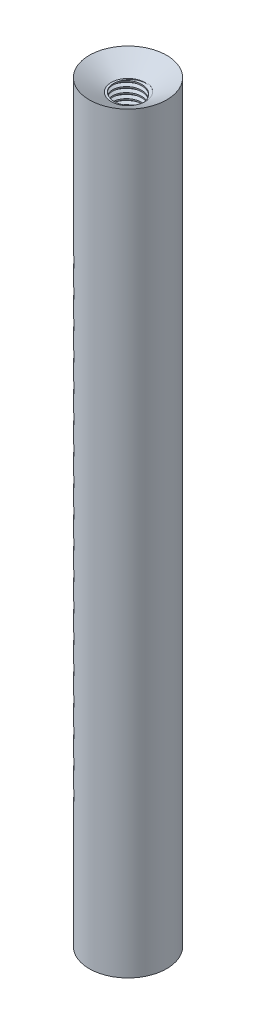
from build123d import *

# Parameters (mm, degrees)
SKETCH1_R                 = 9.25
BOSS_EXTRUDE1_DEPTH       = 180
M8X1_0_TAPPED_HOLE1_D     = 7
M8X1_0_TAPPED_HOLE1_DEPTH = 16.896987833
M8X1_0_TAPPED_HOLE1_TIP   = 2.103012167
M8X1_0_TAPPED_HOLE2_D     = 7
M8X1_0_TAPPED_HOLE2_DEPTH = 16.896987833
M8X1_0_TAPPED_HOLE2_TIP   = 2.103012167
CUT_EXTRUDE2_DEPTH        = 181.474721222
CUT_EXTRUDE2_DEPTH_BACK   = 181.474721222
THREAD1_PITCH             = 1.25
THREAD2_PITCH             = 1.25


with BuildPart() as part:
    # Sketch1 → Boss-Extrude1 (new body)
    with BuildSketch(Plane(origin=(0, 0, 0), x_dir=(1, 0, 0), z_dir=(0, 1, 0))):
        with Locations(Location((0, 0, 0), (0, 0, 90))):
            Circle(SKETCH1_R)
    extrude(amount=BOSS_EXTRUDE1_DEPTH)

    # Sketch6 → Cut-Revolve2 (revolve, cut)
    with BuildSketch(Plane.XY, mode=Mode.PRIVATE) as cut_revolve2_sk:
        Polygon((0, 177), (4, 177), (39.314590237, 197.17976585), (0, 197.17976585), align=None)
        Polygon((0, 3), (4, 3), (39.314590237, -17.17976585), (0, -17.17976585), align=None)
    revolve(cut_revolve2_sk.sketch.rotate(Axis((0, 270.969491597, 0), (0, -1, 0)), 90), axis=Axis((0, 270.969491597, 0), (0, -1, 0)), mode=Mode.SUBTRACT)

    # M8x1.0 Tapped Hole1
    with Locations(Plane(origin=(0, 177, 0), x_dir=(1, 0, 0), z_dir=(0, 1, 0))):
        with Locations((0, 0)):
            Hole(M8X1_0_TAPPED_HOLE1_D / 2, depth=M8X1_0_TAPPED_HOLE1_DEPTH)
            with Locations((0, 0, -(M8X1_0_TAPPED_HOLE1_DEPTH + M8X1_0_TAPPED_HOLE1_TIP / 2))):  # 118° drill point
                Cone(0, M8X1_0_TAPPED_HOLE1_D / 2, M8X1_0_TAPPED_HOLE1_TIP, mode=Mode.SUBTRACT)

    # M8x1.0 Tapped Hole2
    with Locations(Plane(origin=(0, 3, 0), x_dir=(-1, 0, 0), z_dir=(0, -1, 0))):
        with Locations((0, 0)):
            Hole(M8X1_0_TAPPED_HOLE2_D / 2, depth=M8X1_0_TAPPED_HOLE2_DEPTH)
            with Locations((0, 0, -(M8X1_0_TAPPED_HOLE2_DEPTH + M8X1_0_TAPPED_HOLE2_TIP / 2))):  # 118° drill point
                Cone(0, M8X1_0_TAPPED_HOLE2_D / 2, M8X1_0_TAPPED_HOLE2_TIP, mode=Mode.SUBTRACT)

    # Sketch16 → Cut-Extrude2 (cut, two sides: drawn at the far end of the back side and taken through both)
    with BuildSketch(Plane.XY.offset(-CUT_EXTRUDE2_DEPTH_BACK)):
        Polygon((-9.25, 34.5), (-9.25, 29.5), (-5.25, 30.9), (-5.25, 33.1), align=None)
        Polygon((-9.25, 41), (-9.25, 36), (-5.25, 37.4), (-5.25, 39.6), align=None)
        Polygon((-9.25, 47.5), (-9.25, 42.5), (-5.25, 43.9), (-5.25, 46.1), align=None)
        Polygon((-9.25, 54), (-9.25, 49), (-5.25, 50.4), (-5.25, 52.6), align=None)
        Polygon((-9.25, 60.5), (-9.25, 55.5), (-5.25, 56.9), (-5.25, 59.1), align=None)
        Polygon((-9.25, 67), (-9.25, 62), (-5.25, 63.4), (-5.25, 65.6), align=None)
        Polygon((-9.25, 73.5), (-9.25, 68.5), (-5.25, 69.9), (-5.25, 72.1), align=None)
        Polygon((-9.25, 80), (-9.25, 75), (-5.25, 76.4), (-5.25, 78.6), align=None)
        Polygon((-9.25, 86.5), (-9.25, 81.5), (-5.25, 82.9), (-5.25, 85.1), align=None)
        Polygon((-9.25, 93), (-9.25, 88), (-5.25, 89.4), (-5.25, 91.6), align=None)
        Polygon((-9.25, 99.5), (-9.25, 94.5), (-5.25, 95.9), (-5.25, 98.1), align=None)
        Polygon((-9.25, 106), (-9.25, 101), (-5.25, 102.4), (-5.25, 104.6), align=None)
        Polygon((-9.25, 112.5), (-9.25, 107.5), (-5.25, 108.9), (-5.25, 111.1), align=None)
        Polygon((-9.25, 119), (-9.25, 114), (-5.25, 115.4), (-5.25, 117.6), align=None)
        Polygon((-9.25, 125.5), (-9.25, 120.5), (-5.25, 121.9), (-5.25, 124.1), align=None)
        Polygon((-9.25, 132), (-9.25, 127), (-5.25, 128.4), (-5.25, 130.6), align=None)
        Polygon((-9.25, 138.5), (-9.25, 133.5), (-5.25, 134.9), (-5.25, 137.1), align=None)
        Polygon((-9.25, 145), (-9.25, 140), (-5.25, 141.4), (-5.25, 143.6), align=None)
    extrude(amount=CUT_EXTRUDE2_DEPTH + CUT_EXTRUDE2_DEPTH_BACK, mode=Mode.SUBTRACT)

    # Thread1: the profile of Thread Profile1 profile screwed along a right-hand helix of 12 turns, 8 arcs to a turn; built about Z, then put on its axis
    thread1_z = Axis((0, 0, 0), (0, 0, 1))
    thread1_corners = [(3.4997, 0, -0.000173205), (4.176582344, 0, 0.390624998), (4.176582344, 0, 0.546874998), (3.4997, 0, 0.937673202)]
    with BuildLine(mode=Mode.PRIVATE) as thread1_profile:
        Line(thread1_corners[0], thread1_corners[1])
        Line(thread1_corners[1], thread1_corners[2])
        Line(thread1_corners[2], thread1_corners[3])
        Line(thread1_corners[3], thread1_corners[0])
    thread1_cap = Face(thread1_profile.wire())
    thread1_turn_angles = [0, 22.5, 45, 67.5, 90, 112.5, 135, 157.5, 180, 202.5, 225, 247.5, 270, 292.5, 315, 337.5, 360]
    thread1_turn_weights = [1, 0.9238795325112867, 1, 0.9238795325112867, 1, 0.9238795325112867, 1, 0.9238795325112867, 1, 0.9238795325112867, 1, 0.9238795325112867, 1, 0.9238795325112867, 1, 0.9238795325112867, 1]
    thread1_turn_rails = [Edge.make_bspline([Vector(p[0], p[1], 0).rotate(thread1_z, thread1_turn_angles[k]) / thread1_turn_weights[k] + Vector(0, 0, p[2] + THREAD1_PITCH * thread1_turn_angles[k] / 360) for k in range(17)], [0, 0, 0, 1, 1, 2, 2, 3, 3, 4, 4, 5, 5, 6, 6, 7, 7, 8, 8, 8], 2, thread1_turn_weights) for p in thread1_corners]
    thread1_turn_sides = [Face.make_surface_from_curves(thread1_turn_rails[p[0]], thread1_turn_rails[p[1]]) for p in [(0, 1), (1, 2), (2, 3), (3, 0)]]
    thread1 = Plane(origin=(0, 2, 0), x_dir=(1, 0, 0), z_dir=(0, 1, 0)) * Solid(Shell([*[p.moved(Location((0, 0, THREAD1_PITCH * i))) for i in range(12) for p in thread1_turn_sides], thread1_cap, thread1_cap.rotate(thread1_z, 4320).moved(Location((0, 0, THREAD1_PITCH * 4320 / 360)))]))
    add(thread1, mode=Mode.SUBTRACT)

    # Thread2: the profile of Thread Profile3 profile screwed along a right-hand helix of 12 turns, 8 arcs to a turn; built about Z, then put on its axis
    thread2_z = Axis((0, 0, 0), (0, 0, 1))
    thread2_corners = [(3.4997, 0, -0.000173205), (4.176582344, 0, 0.390624998), (4.176582344, 0, 0.546874998), (3.4997, 0, 0.937673202)]
    with BuildLine(mode=Mode.PRIVATE) as thread2_profile:
        Line(thread2_corners[0], thread2_corners[1])
        Line(thread2_corners[1], thread2_corners[2])
        Line(thread2_corners[2], thread2_corners[3])
        Line(thread2_corners[3], thread2_corners[0])
    thread2_cap = Face(thread2_profile.wire())
    thread2_turn_angles = [0, 22.5, 45, 67.5, 90, 112.5, 135, 157.5, 180, 202.5, 225, 247.5, 270, 292.5, 315, 337.5, 360]
    thread2_turn_weights = [1, 0.9238795325112867, 1, 0.9238795325112867, 1, 0.9238795325112867, 1, 0.9238795325112867, 1, 0.9238795325112867, 1, 0.9238795325112867, 1, 0.9238795325112867, 1, 0.9238795325112867, 1]
    thread2_turn_rails = [Edge.make_bspline([Vector(p[0], p[1], 0).rotate(thread2_z, thread2_turn_angles[k]) / thread2_turn_weights[k] + Vector(0, 0, p[2] + THREAD2_PITCH * thread2_turn_angles[k] / 360) for k in range(17)], [0, 0, 0, 1, 1, 2, 2, 3, 3, 4, 4, 5, 5, 6, 6, 7, 7, 8, 8, 8], 2, thread2_turn_weights) for p in thread2_corners]
    thread2_turn_sides = [Face.make_surface_from_curves(thread2_turn_rails[p[0]], thread2_turn_rails[p[1]]) for p in [(0, 1), (1, 2), (2, 3), (3, 0)]]
    thread2 = Plane(origin=(0, 178, 0), x_dir=(-1, 0, 0), z_dir=(0, -1, 0)) * Solid(Shell([*[p.moved(Location((0, 0, THREAD2_PITCH * i))) for i in range(12) for p in thread2_turn_sides], thread2_cap, thread2_cap.rotate(thread2_z, 4320).moved(Location((0, 0, THREAD2_PITCH * 4320 / 360)))]))
    add(thread2, mode=Mode.SUBTRACT)


solid = part.part
